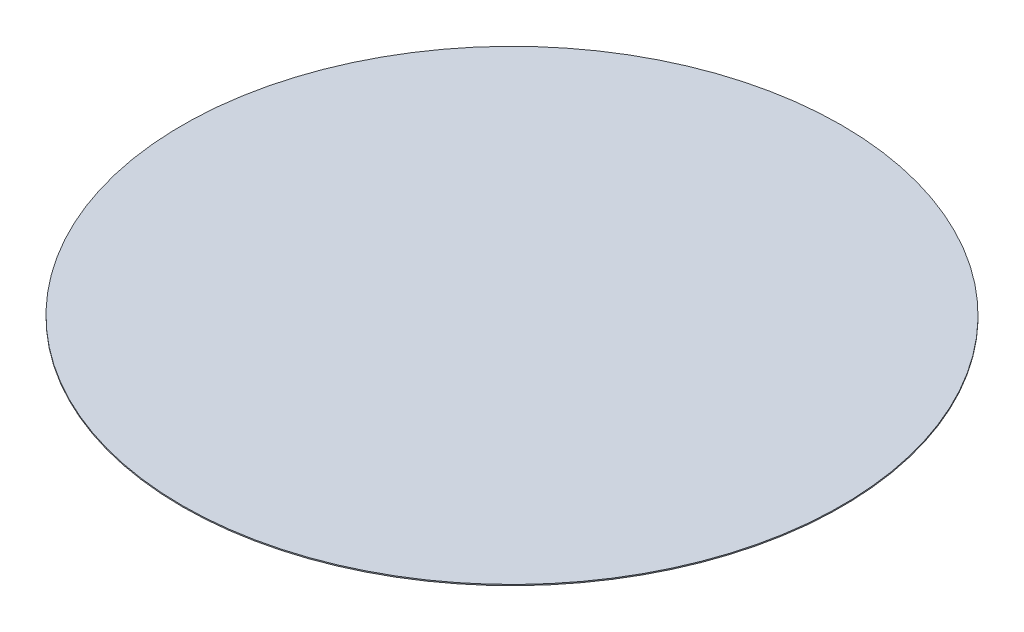
from build123d import *

# Parameters (mm, degrees)
SKETCH2_R                = 609.6
BOSS_EXTRUDE1_DEPTH      = 6
CONVERT_SOLID1_OUTLINE_R = 609.6
CONVERT_SOLID1_DEPTH     = 4


# Read off the part's stored shape, not the designer's step: Convert-Solid1
with BuildPart() as part:
    # Sketch2 → Boss-Extrude1 (new body)
    with BuildSketch(Plane(origin=(0, 0, 0), x_dir=(1, 0, 0), z_dir=(0, 1, 0))):
        with Locations(Location((0, 0, 0), (0, 0, 270))):
            Circle(SKETCH2_R)
    extrude(amount=BOSS_EXTRUDE1_DEPTH)

    # Convert-Solid1 outline → Convert-Solid1 (cut)
    with BuildSketch(Plane(origin=(0, 0, 0), x_dir=(1, 0, 0), z_dir=(0, 1, 0))):
        Circle(CONVERT_SOLID1_OUTLINE_R)
    extrude(amount=CONVERT_SOLID1_DEPTH, mode=Mode.SUBTRACT)


solid = part.part
